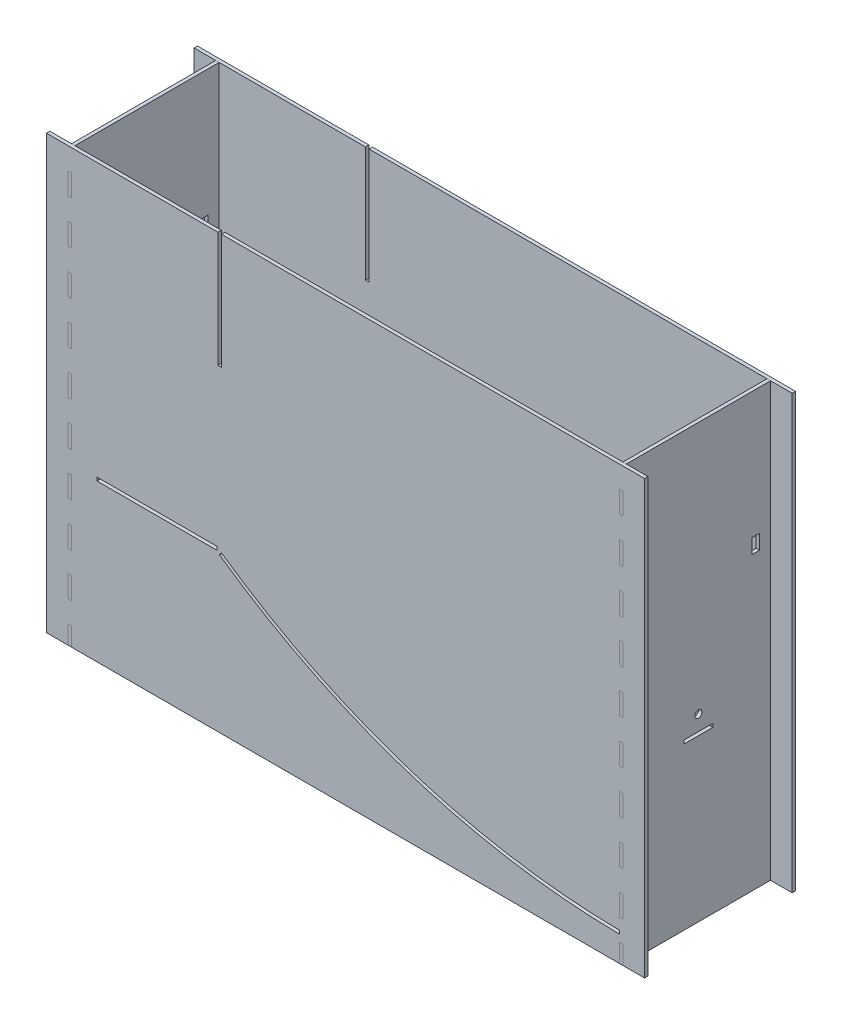
from build123d import *

# Parameters (mm, degrees)
SKETCH1_W                  = 488.5944
SKETCH1_H                  = 132.9944
SKETCH1_W_2                = 482.6
SKETCH1_H_2                = 127
BASE_EXTRUDE_DEPTH         = 2.9972
SKETCH1_3_W                = 488.5944
SKETCH1_3_H                = 132.9944
SKETCH1_3_W_2              = 482.6
SKETCH1_3_H_2              = 127
WALL_EXTRUDE_DEPTH         = 383.9972
CUT_EXTRUDE7_START         = -132.9944
CUT_EXTRUDE7_OUTLINE_W     = 3.175
CUT_EXTRUDE7_OUTLINE_H     = 101.6
CUT_EXTRUDE7_OUTLINE_W_2   = 105.8672
CUT_EXTRUDE7_OUTLINE_H_2   = 2.9972
CUT_EXTRUDE7_DEPTH         = 132.9944
SKETCH19_R                 = 3.175
SKETCH19_W                 = 25.4
SKETCH19_H                 = 2.9972
SKETCH19_W_2               = 6.477
SKETCH19_H_2               = 12.827
SIDE_CUTS_DEPTH            = 625.980171627
SKETCH23_W                 = 19.05
SKETCH23_H                 = 383.9972
BOSS_EXTRUDE1_DEPTH        = 2.9972
BOSS_EXTRUDE2_START        = -132.9944
SKETCH23_2_W               = 19.05
SKETCH23_2_H               = 383.9972
BOSS_EXTRUDE2_DEPTH        = 2.9972
SKETCH21_W                 = 12.827
SKETCH21_H                 = 6.477
SKETCH21_W_2               = 6.477
SKETCH21_H_2               = 12.827
SKETCH21_W_3               = 3.175
BOTTOM_SUPPORT_HOLES_DEPTH = 471.348248603
SPLIT1_START               = -244.2972
SPLIT1_OUTLINE_W           = 12.827
SPLIT1_OUTLINE_H           = 6.477
SPLIT1_OUTLINE_W_2         = 2.9972
SPLIT1_OUTLINE_H_2         = 25.4
SPLIT1_OUTLINE_R           = 3.175
SPLIT1_DEPTH               = 2.9972
SPLIT1_START_2             = 2.9972
SPLIT1_2_OUTLINE_W         = 2.9972
SPLIT1_2_OUTLINE_H         = 127
SPLIT1_2_DEPTH             = 381
SPLIT1_3_OUTLINE_W         = 2.9972
SPLIT1_3_OUTLINE_H         = 12.0904
SPLIT1_3_DEPTH             = 19.19986
SPLIT1_START_3             = 38.39972
SPLIT1_4_OUTLINE_W         = 2.9972
SPLIT1_4_OUTLINE_H         = 2.9972
SPLIT1_4_DEPTH             = 19.19986
SPLIT1_START_4             = 76.79944
SPLIT1_5_OUTLINE_W         = 2.9972
SPLIT1_5_OUTLINE_H         = 2.9972
SPLIT1_5_DEPTH             = 19.19986
SPLIT1_START_5             = 115.19916
SPLIT1_6_OUTLINE_W         = 2.9972
SPLIT1_6_OUTLINE_H         = 2.9972
SPLIT1_6_DEPTH             = 19.19986
SPLIT1_START_6             = 153.59888
SPLIT1_7_OUTLINE_W         = 2.9972
SPLIT1_7_OUTLINE_H         = 2.9972
SPLIT1_7_DEPTH             = 19.19986
SPLIT1_START_7             = 191.9986
SPLIT1_8_OUTLINE_W         = 2.9972
SPLIT1_8_OUTLINE_H         = 2.9972
SPLIT1_8_DEPTH             = 19.19986
SPLIT1_START_8             = 230.39832
SPLIT1_9_OUTLINE_W         = 2.9972
SPLIT1_9_OUTLINE_H         = 2.9972
SPLIT1_9_DEPTH             = 19.19986
SPLIT1_START_9             = 268.79804
SPLIT1_10_OUTLINE_W        = 2.9972
SPLIT1_10_OUTLINE_H        = 2.9972
SPLIT1_10_DEPTH            = 19.19986
SPLIT1_START_10            = 307.19776
SPLIT1_11_OUTLINE_W        = 2.9972
SPLIT1_11_OUTLINE_H        = 2.9972
SPLIT1_11_DEPTH            = 19.19986
SPLIT1_START_11            = 345.59748
SPLIT1_12_OUTLINE_W        = 2.9972
SPLIT1_12_OUTLINE_H        = 2.9972
SPLIT1_12_DEPTH            = 19.19986
SPLIT2_START               = 241.3
SPLIT2_OUTLINE_W           = 12.827
SPLIT2_OUTLINE_H           = 6.477
SPLIT2_OUTLINE_W_2         = 2.9972
SPLIT2_OUTLINE_H_2         = 25.4
SPLIT2_OUTLINE_R           = 3.175
SPLIT2_DEPTH               = 2.9972
SPLIT2_START_2             = 2.9972
SPLIT2_2_OUTLINE_W         = 2.9972
SPLIT2_2_OUTLINE_H         = 127
SPLIT2_2_DEPTH             = 381
SPLIT2_3_OUTLINE_W         = 2.9972
SPLIT2_3_OUTLINE_H         = 12.0904
SPLIT2_3_DEPTH             = 19.19986
SPLIT2_START_3             = 38.39972
SPLIT2_4_OUTLINE_W         = 2.9972
SPLIT2_4_OUTLINE_H         = 2.9972
SPLIT2_4_DEPTH             = 19.19986
SPLIT2_START_4             = 76.79944
SPLIT2_5_OUTLINE_W         = 2.9972
SPLIT2_5_OUTLINE_H         = 2.9972
SPLIT2_5_DEPTH             = 19.19986
SPLIT2_START_5             = 115.19916
SPLIT2_6_OUTLINE_W         = 2.9972
SPLIT2_6_OUTLINE_H         = 2.9972
SPLIT2_6_DEPTH             = 19.19986
SPLIT2_START_6             = 153.59888
SPLIT2_7_OUTLINE_W         = 2.9972
SPLIT2_7_OUTLINE_H         = 2.9972
SPLIT2_7_DEPTH             = 19.19986
SPLIT2_START_7             = 191.9986
SPLIT2_8_OUTLINE_W         = 2.9972
SPLIT2_8_OUTLINE_H         = 2.9972
SPLIT2_8_DEPTH             = 19.19986
SPLIT2_START_8             = 230.39832
SPLIT2_9_OUTLINE_W         = 2.9972
SPLIT2_9_OUTLINE_H         = 2.9972
SPLIT2_9_DEPTH             = 19.19986
SPLIT2_START_9             = 268.79804
SPLIT2_10_OUTLINE_W        = 2.9972
SPLIT2_10_OUTLINE_H        = 2.9972
SPLIT2_10_DEPTH            = 19.19986
SPLIT2_START_10            = 307.19776
SPLIT2_11_OUTLINE_W        = 2.9972
SPLIT2_11_OUTLINE_H        = 2.9972
SPLIT2_11_DEPTH            = 19.19986
SPLIT2_START_11            = 345.59748
SPLIT2_12_OUTLINE_W        = 2.9972
SPLIT2_12_OUTLINE_H        = 2.9972
SPLIT2_12_DEPTH            = 19.19986
SKETCH22_W                 = 526.6944
SKETCH22_H                 = 2.9972
CUT_EXTRUDE5_DEPTH         = 485.24488411


# Read off the part's stored shape, not the designer's step: Cut-Extrude7, Split1, Split2
with BuildPart() as part:
    # Sketch1 → Base Extrude (new body)
    # profile 1 of 2: a face of its own
    with BuildSketch(Plane(origin=(0, 0, 0), x_dir=(1, 0, 0), z_dir=(0, 1, 0))):
        Rectangle(SKETCH1_W, SKETCH1_H)
        Rectangle(SKETCH1_W_2, SKETCH1_H_2, mode=Mode.SUBTRACT)
    # profile 2 of 2: a face of its own
    with BuildSketch(Plane(origin=(0, 0, 0), x_dir=(1, 0, 0), z_dir=(0, 1, 0))):
        Rectangle(SKETCH1_W_2, SKETCH1_H_2)
    extrude(amount=BASE_EXTRUDE_DEPTH)

    # Sketch1<3> → Wall Extrude (add)
    with BuildSketch(Plane(origin=(0, 0, 0), x_dir=(1, 0, 0), z_dir=(0, 1, 0))):
        Rectangle(SKETCH1_3_W, SKETCH1_3_H)
        Rectangle(SKETCH1_3_W_2, SKETCH1_3_H_2, mode=Mode.SUBTRACT)
    extrude(amount=WALL_EXTRUDE_DEPTH)

    # Cut-Extrude7 outline → Cut-Extrude7 (cut)
    with BuildSketch(Plane.XY.offset(66.4972).offset(CUT_EXTRUDE7_START)):
        with BuildLine():
            Line((-109.22, 140.95220632), (-110.939123295, 138.497043813))
            ThreePointArc((-110.939123295, 138.497043813), (56.628682915, 55.314202066), (241.3, 25.4))
            Line((241.3, 25.4), (241.300000052, 28.397366021))
            ThreePointArc((241.300000052, 28.397366021), (57.529970426, 58.172722219), (-109.22, 140.95220632))
        make_face()
        with Locations((-110.8075, 333.1972)):
            Rectangle(CUT_EXTRUDE7_OUTLINE_W, CUT_EXTRUDE7_OUTLINE_H)
        with Locations((-165.9636, 142.45080632)):
            Rectangle(CUT_EXTRUDE7_OUTLINE_W_2, CUT_EXTRUDE7_OUTLINE_H_2)
    extrude(amount=CUT_EXTRUDE7_DEPTH, mode=Mode.SUBTRACT)

    # Sketch19 → Side Cuts (cut, through all)
    with BuildSketch(Plane.ZY.offset(244.2972)):
        with Locations((0, 161.511017861)):
            Circle(SKETCH19_R)
        with Locations((0, 146.550417861)):
            Rectangle(SKETCH19_W, SKETCH19_H)
        with Locations((-50.5587, 266.02310893)):
            Rectangle(SKETCH19_W_2, SKETCH19_H_2)
        with Locations((50.5587, 266.02310893)):
            Rectangle(SKETCH19_W_2, SKETCH19_H_2)
    extrude(amount=-SIDE_CUTS_DEPTH, mode=Mode.SUBTRACT)

    # Sketch23 → Boss-Extrude1 (add)
    with BuildSketch(Plane.XY.offset(66.4972)):
        with Locations((-253.8222, 191.9986)):
            Rectangle(SKETCH23_W, SKETCH23_H)
        with Locations((253.8222, 191.9986)):
            Rectangle(SKETCH23_W, SKETCH23_H)
    extrude(amount=-BOSS_EXTRUDE1_DEPTH)

    # Sketch23<2> → Boss-Extrude2 (add)
    with BuildSketch(Plane.XY.offset(66.4972).offset(BOSS_EXTRUDE2_START)):
        with Locations((-253.8222, 191.9986)):
            Rectangle(SKETCH23_2_W, SKETCH23_2_H)
        with Locations((253.8222, 191.9986)):
            Rectangle(SKETCH23_2_W, SKETCH23_2_H)
    extrude(amount=BOSS_EXTRUDE2_DEPTH)

    # Sketch21 → Bottom Support Holes (cut, through all)
    with BuildSketch(Plane.XZ):
        with Locations((0, 50.5587)):
            Rectangle(SKETCH21_W, SKETCH21_H)
        with Locations((-228.3587, 0)):
            Rectangle(SKETCH21_W_2, SKETCH21_H_2)
        with Locations((0, -50.5587)):
            Rectangle(SKETCH21_W, SKETCH21_H)
        with Locations((230.0097, 0)):
            Rectangle(SKETCH21_W_3, SKETCH21_H_2)
    extrude(amount=-BOTTOM_SUPPORT_HOLES_DEPTH, mode=Mode.SUBTRACT)

    # Split1 2 outline → Split1 2 (cut)
    with BuildSketch(Plane(origin=(0, 0, 0), x_dir=(1, 0, 0), z_dir=(0, 1, 0)).offset(SPLIT1_START_2)):
        with Locations((-242.7986, 0)):
            Rectangle(SPLIT1_2_OUTLINE_W, SPLIT1_2_OUTLINE_H)
    extrude(amount=SPLIT1_2_DEPTH, mode=Mode.SUBTRACT)

    # Split1 3 outline → Split1 3 (cut)
    with BuildSketch(Plane(origin=(0, 0, 0), x_dir=(1, 0, 0), z_dir=(0, 1, 0))):
        with Locations((-242.7986, 60.452)):
            Rectangle(SPLIT1_3_OUTLINE_W, SPLIT1_3_OUTLINE_H)
        with Locations((-242.7986, 36.2712)):
            Rectangle(SPLIT1_3_OUTLINE_W, SPLIT1_3_OUTLINE_H)
        with Locations((-242.7986, 12.0904)):
            Rectangle(SPLIT1_3_OUTLINE_W, SPLIT1_3_OUTLINE_H)
        with Locations((-242.7986, -12.0904)):
            Rectangle(SPLIT1_3_OUTLINE_W, SPLIT1_3_OUTLINE_H)
        with Locations((-242.7986, -36.2712)):
            Rectangle(SPLIT1_3_OUTLINE_W, SPLIT1_3_OUTLINE_H)
        with Locations((-242.7986, -60.452)):
            Rectangle(SPLIT1_3_OUTLINE_W, SPLIT1_3_OUTLINE_H)
    extrude(amount=SPLIT1_3_DEPTH, mode=Mode.SUBTRACT)

    # Split1 4 outline → Split1 4 (cut)
    with BuildSketch(Plane(origin=(0, 0, 0), x_dir=(1, 0, 0), z_dir=(0, 1, 0)).offset(SPLIT1_START_3)):
        with Locations((-242.7986, 64.9986)):
            Rectangle(SPLIT1_4_OUTLINE_W, SPLIT1_4_OUTLINE_H)
        with Locations((-242.7986, -64.9986)):
            Rectangle(SPLIT1_4_OUTLINE_W, SPLIT1_4_OUTLINE_H)
    extrude(amount=SPLIT1_4_DEPTH, mode=Mode.SUBTRACT)

    # Split1 5 outline → Split1 5 (cut)
    with BuildSketch(Plane(origin=(0, 0, 0), x_dir=(1, 0, 0), z_dir=(0, 1, 0)).offset(SPLIT1_START_4)):
        with Locations((-242.7986, 64.9986)):
            Rectangle(SPLIT1_5_OUTLINE_W, SPLIT1_5_OUTLINE_H)
        with Locations((-242.7986, -64.9986)):
            Rectangle(SPLIT1_5_OUTLINE_W, SPLIT1_5_OUTLINE_H)
    extrude(amount=SPLIT1_5_DEPTH, mode=Mode.SUBTRACT)

    # Split1 6 outline → Split1 6 (cut)
    with BuildSketch(Plane(origin=(0, 0, 0), x_dir=(1, 0, 0), z_dir=(0, 1, 0)).offset(SPLIT1_START_5)):
        with Locations((-242.7986, 64.9986)):
            Rectangle(SPLIT1_6_OUTLINE_W, SPLIT1_6_OUTLINE_H)
        with Locations((-242.7986, -64.9986)):
            Rectangle(SPLIT1_6_OUTLINE_W, SPLIT1_6_OUTLINE_H)
    extrude(amount=SPLIT1_6_DEPTH, mode=Mode.SUBTRACT)

    # Split1 7 outline → Split1 7 (cut)
    with BuildSketch(Plane(origin=(0, 0, 0), x_dir=(1, 0, 0), z_dir=(0, 1, 0)).offset(SPLIT1_START_6)):
        with Locations((-242.7986, 64.9986)):
            Rectangle(SPLIT1_7_OUTLINE_W, SPLIT1_7_OUTLINE_H)
        with Locations((-242.7986, -64.9986)):
            Rectangle(SPLIT1_7_OUTLINE_W, SPLIT1_7_OUTLINE_H)
    extrude(amount=SPLIT1_7_DEPTH, mode=Mode.SUBTRACT)

    # Split1 8 outline → Split1 8 (cut)
    with BuildSketch(Plane(origin=(0, 0, 0), x_dir=(1, 0, 0), z_dir=(0, 1, 0)).offset(SPLIT1_START_7)):
        with Locations((-242.7986, 64.9986)):
            Rectangle(SPLIT1_8_OUTLINE_W, SPLIT1_8_OUTLINE_H)
        with Locations((-242.7986, -64.9986)):
            Rectangle(SPLIT1_8_OUTLINE_W, SPLIT1_8_OUTLINE_H)
    extrude(amount=SPLIT1_8_DEPTH, mode=Mode.SUBTRACT)

    # Split1 9 outline → Split1 9 (cut)
    with BuildSketch(Plane(origin=(0, 0, 0), x_dir=(1, 0, 0), z_dir=(0, 1, 0)).offset(SPLIT1_START_8)):
        with Locations((-242.7986, 64.9986)):
            Rectangle(SPLIT1_9_OUTLINE_W, SPLIT1_9_OUTLINE_H)
        with Locations((-242.7986, -64.9986)):
            Rectangle(SPLIT1_9_OUTLINE_W, SPLIT1_9_OUTLINE_H)
    extrude(amount=SPLIT1_9_DEPTH, mode=Mode.SUBTRACT)

    # Split1 10 outline → Split1 10 (cut)
    with BuildSketch(Plane(origin=(0, 0, 0), x_dir=(1, 0, 0), z_dir=(0, 1, 0)).offset(SPLIT1_START_9)):
        with Locations((-242.7986, 64.9986)):
            Rectangle(SPLIT1_10_OUTLINE_W, SPLIT1_10_OUTLINE_H)
        with Locations((-242.7986, -64.9986)):
            Rectangle(SPLIT1_10_OUTLINE_W, SPLIT1_10_OUTLINE_H)
    extrude(amount=SPLIT1_10_DEPTH, mode=Mode.SUBTRACT)

    # Split1 11 outline → Split1 11 (cut)
    with BuildSketch(Plane(origin=(0, 0, 0), x_dir=(1, 0, 0), z_dir=(0, 1, 0)).offset(SPLIT1_START_10)):
        with Locations((-242.7986, 64.9986)):
            Rectangle(SPLIT1_11_OUTLINE_W, SPLIT1_11_OUTLINE_H)
        with Locations((-242.7986, -64.9986)):
            Rectangle(SPLIT1_11_OUTLINE_W, SPLIT1_11_OUTLINE_H)
    extrude(amount=SPLIT1_11_DEPTH, mode=Mode.SUBTRACT)

    # Split1 12 outline → Split1 12 (cut)
    with BuildSketch(Plane(origin=(0, 0, 0), x_dir=(1, 0, 0), z_dir=(0, 1, 0)).offset(SPLIT1_START_11)):
        with Locations((-242.7986, 64.9986)):
            Rectangle(SPLIT1_12_OUTLINE_W, SPLIT1_12_OUTLINE_H)
        with Locations((-242.7986, -64.9986)):
            Rectangle(SPLIT1_12_OUTLINE_W, SPLIT1_12_OUTLINE_H)
    extrude(amount=SPLIT1_12_DEPTH, mode=Mode.SUBTRACT)

    # Split2 2 outline → Split2 2 (cut)
    with BuildSketch(Plane(origin=(0, 0, 0), x_dir=(1, 0, 0), z_dir=(0, 1, 0)).offset(SPLIT2_START_2)):
        with Locations((242.7986, 0)):
            Rectangle(SPLIT2_2_OUTLINE_W, SPLIT2_2_OUTLINE_H)
    extrude(amount=SPLIT2_2_DEPTH, mode=Mode.SUBTRACT)

    # Split2 3 outline → Split2 3 (cut)
    with BuildSketch(Plane(origin=(0, 0, 0), x_dir=(1, 0, 0), z_dir=(0, 1, 0))):
        with Locations((242.7986, 60.452)):
            Rectangle(SPLIT2_3_OUTLINE_W, SPLIT2_3_OUTLINE_H)
        with Locations((242.7986, 36.2712)):
            Rectangle(SPLIT2_3_OUTLINE_W, SPLIT2_3_OUTLINE_H)
        with Locations((242.7986, 12.0904)):
            Rectangle(SPLIT2_3_OUTLINE_W, SPLIT2_3_OUTLINE_H)
        with Locations((242.7986, -12.0904)):
            Rectangle(SPLIT2_3_OUTLINE_W, SPLIT2_3_OUTLINE_H)
        with Locations((242.7986, -36.2712)):
            Rectangle(SPLIT2_3_OUTLINE_W, SPLIT2_3_OUTLINE_H)
        with Locations((242.7986, -60.452)):
            Rectangle(SPLIT2_3_OUTLINE_W, SPLIT2_3_OUTLINE_H)
    extrude(amount=SPLIT2_3_DEPTH, mode=Mode.SUBTRACT)

    # Split2 4 outline → Split2 4 (cut)
    with BuildSketch(Plane(origin=(0, 0, 0), x_dir=(1, 0, 0), z_dir=(0, 1, 0)).offset(SPLIT2_START_3)):
        with Locations((242.7986, 64.9986)):
            Rectangle(SPLIT2_4_OUTLINE_W, SPLIT2_4_OUTLINE_H)
        with Locations((242.7986, -64.9986)):
            Rectangle(SPLIT2_4_OUTLINE_W, SPLIT2_4_OUTLINE_H)
    extrude(amount=SPLIT2_4_DEPTH, mode=Mode.SUBTRACT)

    # Split2 5 outline → Split2 5 (cut)
    with BuildSketch(Plane(origin=(0, 0, 0), x_dir=(1, 0, 0), z_dir=(0, 1, 0)).offset(SPLIT2_START_4)):
        with Locations((242.7986, 64.9986)):
            Rectangle(SPLIT2_5_OUTLINE_W, SPLIT2_5_OUTLINE_H)
        with Locations((242.7986, -64.9986)):
            Rectangle(SPLIT2_5_OUTLINE_W, SPLIT2_5_OUTLINE_H)
    extrude(amount=SPLIT2_5_DEPTH, mode=Mode.SUBTRACT)

    # Split2 6 outline → Split2 6 (cut)
    with BuildSketch(Plane(origin=(0, 0, 0), x_dir=(1, 0, 0), z_dir=(0, 1, 0)).offset(SPLIT2_START_5)):
        with Locations((242.7986, 64.9986)):
            Rectangle(SPLIT2_6_OUTLINE_W, SPLIT2_6_OUTLINE_H)
        with Locations((242.7986, -64.9986)):
            Rectangle(SPLIT2_6_OUTLINE_W, SPLIT2_6_OUTLINE_H)
    extrude(amount=SPLIT2_6_DEPTH, mode=Mode.SUBTRACT)

    # Split2 7 outline → Split2 7 (cut)
    with BuildSketch(Plane(origin=(0, 0, 0), x_dir=(1, 0, 0), z_dir=(0, 1, 0)).offset(SPLIT2_START_6)):
        with Locations((242.7986, 64.9986)):
            Rectangle(SPLIT2_7_OUTLINE_W, SPLIT2_7_OUTLINE_H)
        with Locations((242.7986, -64.9986)):
            Rectangle(SPLIT2_7_OUTLINE_W, SPLIT2_7_OUTLINE_H)
    extrude(amount=SPLIT2_7_DEPTH, mode=Mode.SUBTRACT)

    # Split2 8 outline → Split2 8 (cut)
    with BuildSketch(Plane(origin=(0, 0, 0), x_dir=(1, 0, 0), z_dir=(0, 1, 0)).offset(SPLIT2_START_7)):
        with Locations((242.7986, 64.9986)):
            Rectangle(SPLIT2_8_OUTLINE_W, SPLIT2_8_OUTLINE_H)
        with Locations((242.7986, -64.9986)):
            Rectangle(SPLIT2_8_OUTLINE_W, SPLIT2_8_OUTLINE_H)
    extrude(amount=SPLIT2_8_DEPTH, mode=Mode.SUBTRACT)

    # Split2 9 outline → Split2 9 (cut)
    with BuildSketch(Plane(origin=(0, 0, 0), x_dir=(1, 0, 0), z_dir=(0, 1, 0)).offset(SPLIT2_START_8)):
        with Locations((242.7986, 64.9986)):
            Rectangle(SPLIT2_9_OUTLINE_W, SPLIT2_9_OUTLINE_H)
        with Locations((242.7986, -64.9986)):
            Rectangle(SPLIT2_9_OUTLINE_W, SPLIT2_9_OUTLINE_H)
    extrude(amount=SPLIT2_9_DEPTH, mode=Mode.SUBTRACT)

    # Split2 10 outline → Split2 10 (cut)
    with BuildSketch(Plane(origin=(0, 0, 0), x_dir=(1, 0, 0), z_dir=(0, 1, 0)).offset(SPLIT2_START_9)):
        with Locations((242.7986, 64.9986)):
            Rectangle(SPLIT2_10_OUTLINE_W, SPLIT2_10_OUTLINE_H)
        with Locations((242.7986, -64.9986)):
            Rectangle(SPLIT2_10_OUTLINE_W, SPLIT2_10_OUTLINE_H)
    extrude(amount=SPLIT2_10_DEPTH, mode=Mode.SUBTRACT)

    # Split2 11 outline → Split2 11 (cut)
    with BuildSketch(Plane(origin=(0, 0, 0), x_dir=(1, 0, 0), z_dir=(0, 1, 0)).offset(SPLIT2_START_10)):
        with Locations((242.7986, 64.9986)):
            Rectangle(SPLIT2_11_OUTLINE_W, SPLIT2_11_OUTLINE_H)
        with Locations((242.7986, -64.9986)):
            Rectangle(SPLIT2_11_OUTLINE_W, SPLIT2_11_OUTLINE_H)
    extrude(amount=SPLIT2_11_DEPTH, mode=Mode.SUBTRACT)

    # Split2 12 outline → Split2 12 (cut)
    with BuildSketch(Plane(origin=(0, 0, 0), x_dir=(1, 0, 0), z_dir=(0, 1, 0)).offset(SPLIT2_START_11)):
        with Locations((242.7986, 64.9986)):
            Rectangle(SPLIT2_12_OUTLINE_W, SPLIT2_12_OUTLINE_H)
        with Locations((242.7986, -64.9986)):
            Rectangle(SPLIT2_12_OUTLINE_W, SPLIT2_12_OUTLINE_H)
    extrude(amount=SPLIT2_12_DEPTH, mode=Mode.SUBTRACT)


with BuildPart() as body_2:
    # Split1 outline → Split1 (new body)
    with BuildSketch(Plane.YZ.offset(SPLIT1_START)):
        Polygon((38.39972, 63.5), (19.19986, 63.5), (19.19986, 66.4972), (0, 66.4972), (0, 54.4068), (2.9972, 54.4068), (2.9972, 42.3164), (0, 42.3164), (0, 30.226), (2.9972, 30.226), (2.9972, 18.1356), (0, 18.1356), (0, 6.0452), (2.9972, 6.0452), (2.9972, -6.0452), (0, -6.0452), (0, -18.1356), (2.9972, -18.1356), (2.9972, -30.226), (0, -30.226), (0, -42.3164), (2.9972, -42.3164), (2.9972, -54.4068), (0, -54.4068), (0, -66.4972), (19.19986, -66.4972), (19.19986, -63.5), (38.39972, -63.5), (38.39972, -66.4972), (57.59958, -66.4972), (57.59958, -63.5), (76.79944, -63.5), (76.79944, -66.4972), (95.9993, -66.4972), (95.9993, -63.5), (115.19916, -63.5), (115.19916, -66.4972), (134.39902, -66.4972), (134.39902, -63.5), (153.59888, -63.5), (153.59888, -66.4972), (172.79874, -66.4972), (172.79874, -63.5), (191.9986, -63.5), (191.9986, -66.4972), (211.19846, -66.4972), (211.19846, -63.5), (230.39832, -63.5), (230.39832, -66.4972), (249.59818, -66.4972), (249.59818, -63.5), (268.79804, -63.5), (268.79804, -66.4972), (287.9979, -66.4972), (287.9979, -63.5), (307.19776, -63.5), (307.19776, -66.4972), (326.39762, -66.4972), (326.39762, -63.5), (345.59748, -63.5), (345.59748, -66.4972), (364.79734, -66.4972), (364.79734, -63.5), (383.9972, -63.5), (383.9972, 63.5), (364.79734, 63.5), (364.79734, 66.4972), (345.59748, 66.4972), (345.59748, 63.5), (326.39762, 63.5), (326.39762, 66.4972), (307.19776, 66.4972), (307.19776, 63.5), (287.9979, 63.5), (287.9979, 66.4972), (268.79804, 66.4972), (268.79804, 63.5), (249.59818, 63.5), (249.59818, 66.4972), (230.39832, 66.4972), (230.39832, 63.5), (211.19846, 63.5), (211.19846, 66.4972), (191.9986, 66.4972), (191.9986, 63.5), (172.79874, 63.5), (172.79874, 66.4972), (153.59888, 66.4972), (153.59888, 63.5), (134.39902, 63.5), (134.39902, 66.4972), (115.19916, 66.4972), (115.19916, 63.5), (95.9993, 63.5), (95.9993, 66.4972), (76.79944, 66.4972), (76.79944, 63.5), (57.59958, 63.5), (57.59958, 66.4972), (38.39972, 66.4972), align=None)
        with Locations((266.02310893, -50.5587)):
            Rectangle(SPLIT1_OUTLINE_W, SPLIT1_OUTLINE_H, mode=Mode.SUBTRACT)
        with Locations((146.550417861, 0)):
            Rectangle(SPLIT1_OUTLINE_W_2, SPLIT1_OUTLINE_H_2, mode=Mode.SUBTRACT)
        with Locations((161.511017861, 0)):
            Circle(SPLIT1_OUTLINE_R, mode=Mode.SUBTRACT)
        with Locations((266.02310893, 50.5587)):
            Rectangle(SPLIT1_OUTLINE_W, SPLIT1_OUTLINE_H, mode=Mode.SUBTRACT)
    extrude(amount=SPLIT1_DEPTH)


with BuildPart() as body_3:
    # Split2 outline → Split2 (new body)
    with BuildSketch(Plane.YZ.offset(SPLIT2_START)):
        Polygon((383.9972, 63.5), (364.79734, 63.5), (364.79734, 66.4972), (345.59748, 66.4972), (345.59748, 63.5), (326.39762, 63.5), (326.39762, 66.4972), (307.19776, 66.4972), (307.19776, 63.5), (287.9979, 63.5), (287.9979, 66.4972), (268.79804, 66.4972), (268.79804, 63.5), (249.59818, 63.5), (249.59818, 66.4972), (230.39832, 66.4972), (230.39832, 63.5), (211.19846, 63.5), (211.19846, 66.4972), (191.9986, 66.4972), (191.9986, 63.5), (172.79874, 63.5), (172.79874, 66.4972), (153.59888, 66.4972), (153.59888, 63.5), (134.39902, 63.5), (134.39902, 66.4972), (115.19916, 66.4972), (115.19916, 63.5), (95.9993, 63.5), (95.9993, 66.4972), (76.79944, 66.4972), (76.79944, 63.5), (57.59958, 63.5), (57.59958, 66.4972), (38.39972, 66.4972), (38.39972, 63.5), (19.19986, 63.5), (19.19986, 66.4972), (0, 66.4972), (0, 54.4068), (2.9972, 54.4068), (2.9972, 42.3164), (0, 42.3164), (0, 30.226), (2.9972, 30.226), (2.9972, 18.1356), (0, 18.1356), (0, 6.0452), (2.9972, 6.0452), (2.9972, -6.0452), (0, -6.0452), (0, -18.1356), (2.9972, -18.1356), (2.9972, -30.226), (0, -30.226), (0, -42.3164), (2.9972, -42.3164), (2.9972, -54.4068), (0, -54.4068), (0, -66.4972), (19.19986, -66.4972), (19.19986, -63.5), (38.39972, -63.5), (38.39972, -66.4972), (57.59958, -66.4972), (57.59958, -63.5), (76.79944, -63.5), (76.79944, -66.4972), (95.9993, -66.4972), (95.9993, -63.5), (115.19916, -63.5), (115.19916, -66.4972), (134.39902, -66.4972), (134.39902, -63.5), (153.59888, -63.5), (153.59888, -66.4972), (172.79874, -66.4972), (172.79874, -63.5), (191.9986, -63.5), (191.9986, -66.4972), (211.19846, -66.4972), (211.19846, -63.5), (230.39832, -63.5), (230.39832, -66.4972), (249.59818, -66.4972), (249.59818, -63.5), (268.79804, -63.5), (268.79804, -66.4972), (287.9979, -66.4972), (287.9979, -63.5), (307.19776, -63.5), (307.19776, -66.4972), (326.39762, -66.4972), (326.39762, -63.5), (345.59748, -63.5), (345.59748, -66.4972), (364.79734, -66.4972), (364.79734, -63.5), (383.9972, -63.5), align=None)
        with Locations((266.02310893, -50.5587)):
            Rectangle(SPLIT2_OUTLINE_W, SPLIT2_OUTLINE_H, mode=Mode.SUBTRACT)
        with Locations((146.550417861, 0)):
            Rectangle(SPLIT2_OUTLINE_W_2, SPLIT2_OUTLINE_H_2, mode=Mode.SUBTRACT)
        with Locations((161.511017861, 0)):
            Circle(SPLIT2_OUTLINE_R, mode=Mode.SUBTRACT)
        with Locations((266.02310893, 50.5587)):
            Rectangle(SPLIT2_OUTLINE_W, SPLIT2_OUTLINE_H, mode=Mode.SUBTRACT)
    extrude(amount=SPLIT2_DEPTH)


with BuildPart() as cut_extrude5_tool:
    # Sketch22 → Cut-Extrude5 (new, through all)
    with BuildSketch(Plane.XY.offset(66.4972)):
        with Locations((0, 1.4986)):
            Rectangle(SKETCH22_W, SKETCH22_H)
    extrude(amount=-CUT_EXTRUDE5_DEPTH)


with BuildPart() as part_1:
    add(part.part)

    # Cut-Extrude5: cut by cut_extrude5_tool
    add(cut_extrude5_tool.part, mode=Mode.SUBTRACT)


with BuildPart() as body_2_1:
    add(body_2.part)

    # Cut-Extrude5: cut by cut_extrude5_tool
    add(cut_extrude5_tool.part, mode=Mode.SUBTRACT)


with BuildPart() as body_3_1:
    add(body_3.part)

    # Cut-Extrude5: cut by cut_extrude5_tool
    add(cut_extrude5_tool.part, mode=Mode.SUBTRACT)


solid = Compound([part_1.part, body_2_1.part, body_3_1.part])
